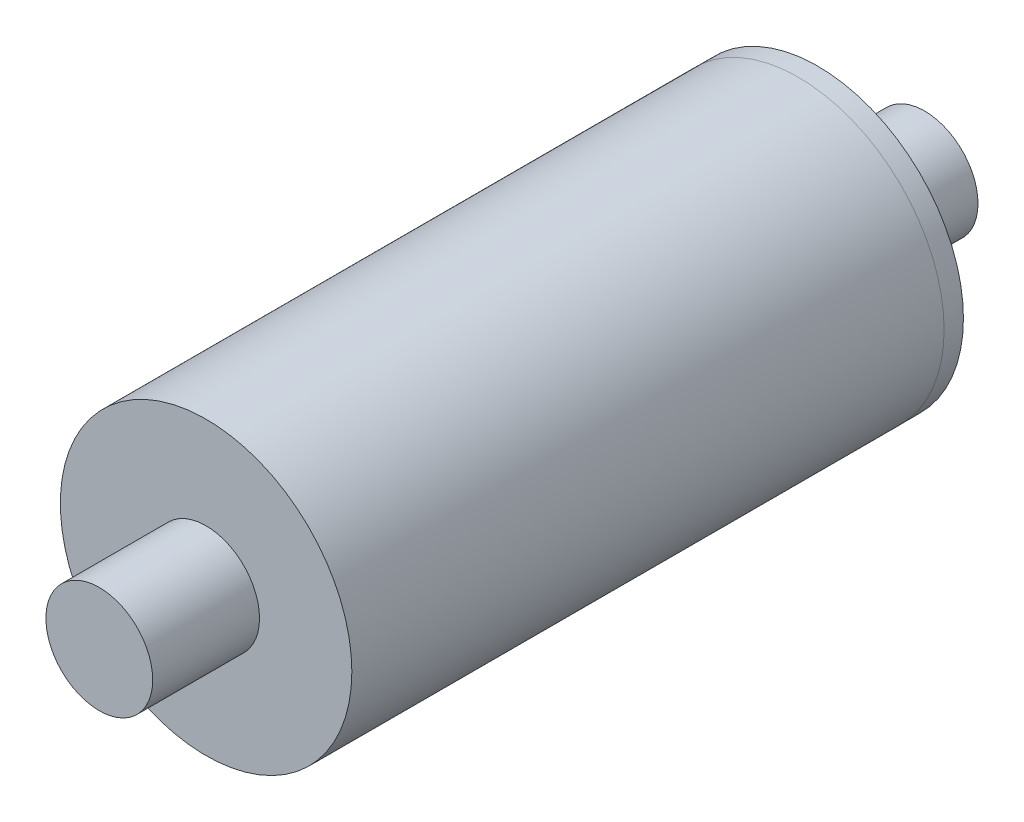
from build123d import *

# Parameters (mm, degrees)
SKETCH1_R           = 5.5
BOSS_EXTRUDE1_DEPTH = 11
SKETCH3_R           = 15
BOSS_EXTRUDE2_DEPTH = 2
SKETCH4_R           = 15.011076053
SKETCH4_R_2         = 13.011076053
BOSS_EXTRUDE3_DEPTH = 59
SKETCH5_R           = 15.011076053
BOSS_EXTRUDE4_DEPTH = 2
CAVITY1_OUTLINE_R   = 1.25
CAVITY1_DEPTH       = 8
SKETCH6_R           = 1.25
CUT_EXTRUDE1_DEPTH  = 8


# Read off the part's stored shape, not the designer's step: Cavity1
with BuildPart() as part:
    # Sketch1 → Boss-Extrude1 (new body)
    with BuildSketch(Plane.XY):
        with Locations((0.700759494, -0.350379747)):
            Circle(SKETCH1_R)
    boss_extrude1 = extrude(amount=BOSS_EXTRUDE1_DEPTH)

    # Sketch3 → Boss-Extrude2 (add)
    with BuildSketch(Plane.XY.offset(11)):
        with Locations((0.700759494, -0.350379747)):
            Circle(SKETCH3_R)
    extrude(amount=BOSS_EXTRUDE2_DEPTH)

    # Sketch4 → Boss-Extrude3 (add)
    with BuildSketch(Plane.XY.offset(13)):
        with Locations((0.700759494, -0.350379747)):
            Circle(SKETCH4_R)
        with Locations((0.700759494, -0.350379747)):
            Circle(SKETCH4_R_2, mode=Mode.SUBTRACT)
    extrude(amount=BOSS_EXTRUDE3_DEPTH)

    # Sketch5 → Boss-Extrude4 (add)
    with BuildSketch(Plane.XY.offset(72)):
        with Locations((0.700759494, -0.350379747)):
            Circle(SKETCH5_R)
    extrude(amount=BOSS_EXTRUDE4_DEPTH)

    # Mirror1: Boss-Extrude1 across plane
    add(boss_extrude1.mirror(Plane.XY.offset(42.5)))

    # Cavity1 outline → Cavity1 (cut)
    with BuildSketch(Plane.XY):
        with BuildLine():
            Line((3.338761962, -0.602258645), (0.613426942, 2.29818081))
            ThreePointArc((0.613426942, 2.29818081), (-1.113870906, 1.580841761), (-1.937242974, -0.098500849))
            Line((-1.937242974, -0.098500849), (0.788092045, -2.998940304))
            ThreePointArc((0.788092045, -2.998940304), (2.515389893, -2.281601255), (3.338761962, -0.602258645))
        make_face()
        with Locations((0.700759494, -0.350379747)):
            Circle(CAVITY1_OUTLINE_R, mode=Mode.SUBTRACT)
    extrude(amount=CAVITY1_DEPTH, mode=Mode.SUBTRACT)

    # Sketch6 → Cut-Extrude1 (cut)
    with BuildSketch(Plane(origin=(0, 0, 0), x_dir=(-1, 0, 0), z_dir=(0, 0, -1))):
        with Locations((-0.700759494, -0.350379747)):
            Circle(SKETCH6_R)
    extrude(amount=-CUT_EXTRUDE1_DEPTH, mode=Mode.SUBTRACT)


solid = part.part
